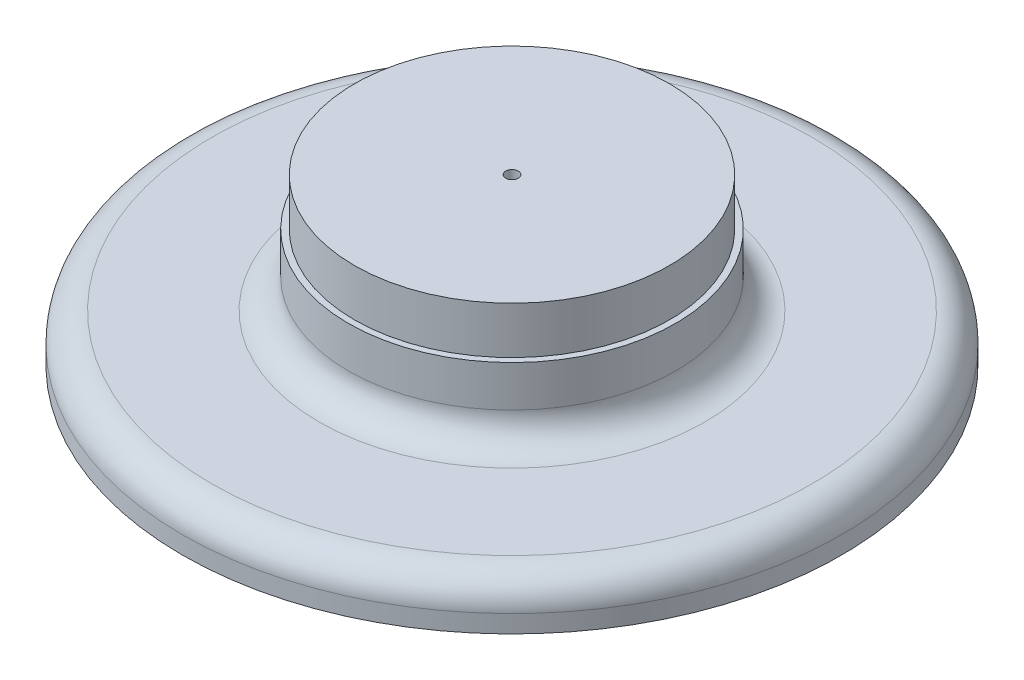
from build123d import *

# Parameters (mm, degrees)
SKETCH1_R                                           = 84.9884
BOSS_EXTRUDE1_DEPTH                                 = 88.9
SKETCH1_3_R                                         = 88.265
SKETCH1_3_R_2                                       = 84.9884
BOSS_EXTRUDE2_DEPTH                                 = 63.5
SKETCH1_4_R                                         = 177.8
SKETCH1_4_R_2                                       = 88.265
BOSS_EXTRUDE3_DEPTH                                 = 25.4
CSK_FOR_1_4_FLAT_HEAD_MACHINE_SCREW_100_D           = 6.7564
CSK_FOR_1_4_FLAT_HEAD_MACHINE_SCREW_100_CSINK_D     = 12.8778
CSK_FOR_1_4_FLAT_HEAD_MACHINE_SCREW_100_CSINK_ANGLE = 100
FILLET1_R                                           = 15.875
FILLET2_R                                           = 15.875


with BuildPart() as part:
    # Sketch1 → Boss-Extrude1 (new body)
    with BuildSketch(Plane(origin=(0, 0, 0), x_dir=(1, 0, 0), z_dir=(0, 1, 0))):
        Circle(SKETCH1_R)
    extrude(amount=BOSS_EXTRUDE1_DEPTH)

    # Sketch1<3> → Boss-Extrude2 (add)
    with BuildSketch(Plane(origin=(0, 0, 0), x_dir=(1, 0, 0), z_dir=(0, 1, 0))):
        Circle(SKETCH1_3_R)
        Circle(SKETCH1_3_R_2, mode=Mode.SUBTRACT)
    extrude(amount=BOSS_EXTRUDE2_DEPTH)

    # Sketch1<4> → Boss-Extrude3 (add)
    with BuildSketch(Plane(origin=(0, 0, 0), x_dir=(1, 0, 0), z_dir=(0, 1, 0))):
        Circle(SKETCH1_4_R)
        Circle(SKETCH1_4_R_2, mode=Mode.SUBTRACT)
    extrude(amount=BOSS_EXTRUDE3_DEPTH)

    # CSK for 1/4 Flat Head Machine Screw (100)1 (through all)
    with Locations(Plane(origin=(0, 0, 0), x_dir=(-1, 0, 0), z_dir=(0, -1, 0))):
        with Locations((0, 0)):
            CounterSinkHole(CSK_FOR_1_4_FLAT_HEAD_MACHINE_SCREW_100_D / 2, CSK_FOR_1_4_FLAT_HEAD_MACHINE_SCREW_100_CSINK_D / 2, counter_sink_angle=CSK_FOR_1_4_FLAT_HEAD_MACHINE_SCREW_100_CSINK_ANGLE)

    # Fillet1
    fillet1_edges = [part.edges().sort_by_distance(p)[0] for p in [
        (-88.265, 25.4, 0),
    ]]
    fillet(fillet1_edges, radius=FILLET1_R)

    # Fillet2
    fillet2_edges = [part.edges().sort_by_distance(p)[0] for p in [
        (-177.8, 25.4, 0),
    ]]
    fillet(fillet2_edges, radius=FILLET2_R)


solid = part.part
